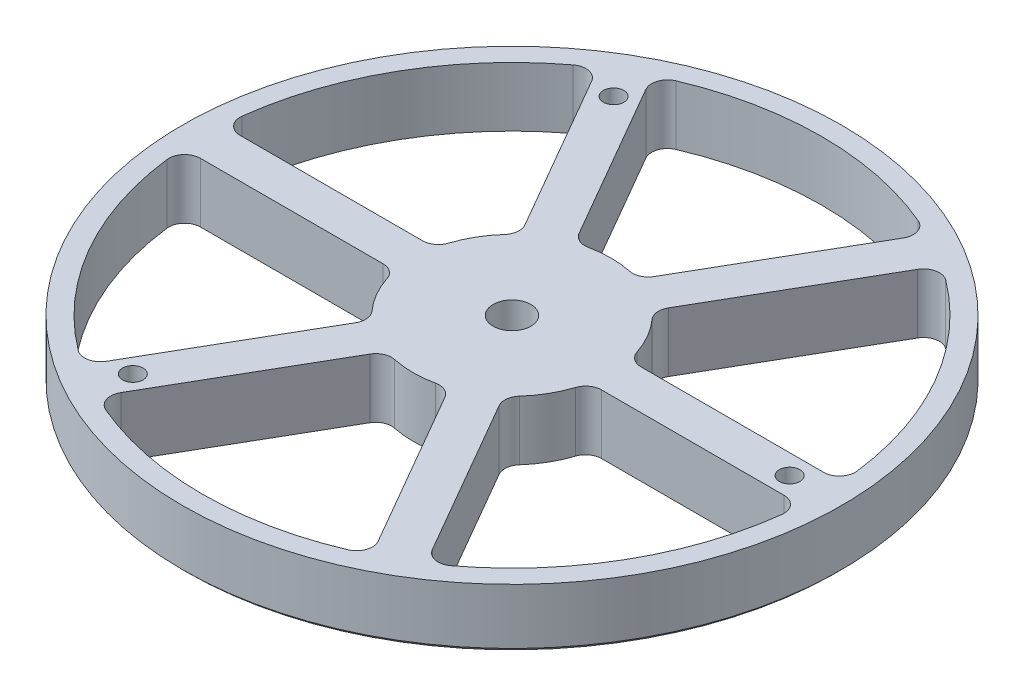
from build123d import *

# Parameters (mm, degrees)
SKETCH2_W                    = 83.09991
SKETCH2_H                    = 15
F_6_0_204_DIAMETER_HOLE1_D   = 5.1816
CIRPATTERN3_COUNT            = 3
CUT_EXTRUDE1_DEPTH           = 119.474427975
FILLET1_R                    = 4
CIRPATTERN4_COUNT            = 6
FILLET1_OF_CIRPATTERN4_R     = 4
CHAMFER2_SIZE                = 1
F_3_8_0_375_DIAMETER_HOLE1_D = 9.525


with BuildPart() as part:
    # Sketch2 → Revolve1 (revolve)
    with BuildSketch(Plane(origin=(0, 0, 0), x_dir=(0, 0, -1), z_dir=(1, 0, 0))):
        with Locations((-41.549955, 7.5)):
            Rectangle(SKETCH2_W, SKETCH2_H)
    revolve(axis=Axis((0, -0.75, 0), (0, 1, 0)))

    # #6 (0.204) Diameter Hole1 (through all)
    with Locations(Plane(origin=(0, 15, 0), x_dir=(1, 0, 0), z_dir=(0, 1, 0))):
        with Locations((-35, 60.621778265)):
            f_6_0_204_diameter_hole1 = Hole(F_6_0_204_DIAMETER_HOLE1_D / 2)

    # CirPattern3: #6 (0.204) Diameter Hole1 ×3 about axis
    cirpattern3_axis = Axis((0, -0.75, 0), (0, 1, 0))
    for i in range(1, CIRPATTERN3_COUNT):
        add(f_6_0_204_diameter_hole1.rotate(cirpattern3_axis, i * 360 / CIRPATTERN3_COUNT), mode=Mode.SUBTRACT)

    # Sketch8 → Cut-Extrude1 (cut, through all)
    with BuildSketch(Plane(origin=(0, 15, 0), x_dir=(1, 0, 0), z_dir=(0, 1, 0))):
        with BuildLine():
            Line((-7.917321695, 23.713203436), (-34.639720113, 69.997755196))
            ThreePointArc((-34.639720113, 69.997755196), (0, 78.09991), (34.639720113, 69.997755196))
            Line((34.639720113, 69.997755196), (7.917321695, 23.713203436))
            ThreePointArc((7.917321695, 23.713203436), (0, 25), (-7.917321695, 23.713203436))
        make_face()
    cut_extrude1 = extrude(amount=-CUT_EXTRUDE1_DEPTH, mode=Mode.SUBTRACT)

    # Fillet1
    fillet1_edges = [part.edges().sort_by_distance(p)[0] for p in [
        (7.917321695, 7.5, -23.713203436),
        (34.639720113, 7.5, -69.997755196),
        (-7.917321695, 7.5, -23.713203436),
        (-34.639720113, 7.5, -69.997755196),
    ]]
    fillet(fillet1_edges, radius=FILLET1_R)

    # CirPattern4: Cut-Extrude1 ×6 about axis
    cirpattern4_axis = Axis((0, -0.75, 0), (0, 1, 0))
    for i in range(1, CIRPATTERN4_COUNT):
        add(cut_extrude1.rotate(cirpattern4_axis, i * 360 / CIRPATTERN4_COUNT), mode=Mode.SUBTRACT)

    # Fillet1 of CirPattern4
    fillet1_of_cirpattern4_edges = [part.edges().sort_by_distance(p)[0] for p in [
        (-16.577575733, 7.5, -18.713203436),
        (-43.299974151, 7.5, -64.997755196),
        (-24.494897428, 7.5, -5),
        (-77.939694264, 7.5, -5),
        (-24.494897428, 7.5, 5),
        (-77.939694264, 7.5, 5),
        (-16.577575733, 7.5, 18.713203436),
        (-43.299974151, 7.5, 64.997755196),
        (-7.917321695, 7.5, 23.713203436),
        (-34.639720113, 7.5, 69.997755196),
        (7.917321695, 7.5, 23.713203436),
        (34.639720113, 7.5, 69.997755196),
        (16.577575733, 7.5, 18.713203436),
        (43.299974151, 7.5, 64.997755196),
        (24.494897428, 7.5, 5),
        (77.939694264, 7.5, 5),
        (24.494897428, 7.5, -5),
        (77.939694264, 7.5, -5),
        (16.577575733, 7.5, -18.713203436),
        (43.299974151, 7.5, -64.997755196),
    ]]
    fillet(fillet1_of_cirpattern4_edges, radius=FILLET1_OF_CIRPATTERN4_R)

    # Chamfer2
    chamfer2_edges = [part.edges().sort_by_distance(p)[0] for p in [
        (0, 0, -83.09991),
    ]]
    chamfer(chamfer2_edges, length=CHAMFER2_SIZE)

    # 3/8 (0.375) Diameter Hole1 (through all)
    with Locations(Plane(origin=(0, 0, 0), x_dir=(-1, 0, 0), z_dir=(0, -1, 0))):
        with Locations((0, 0)):
            Hole(F_3_8_0_375_DIAMETER_HOLE1_D / 2)


solid = part.part
